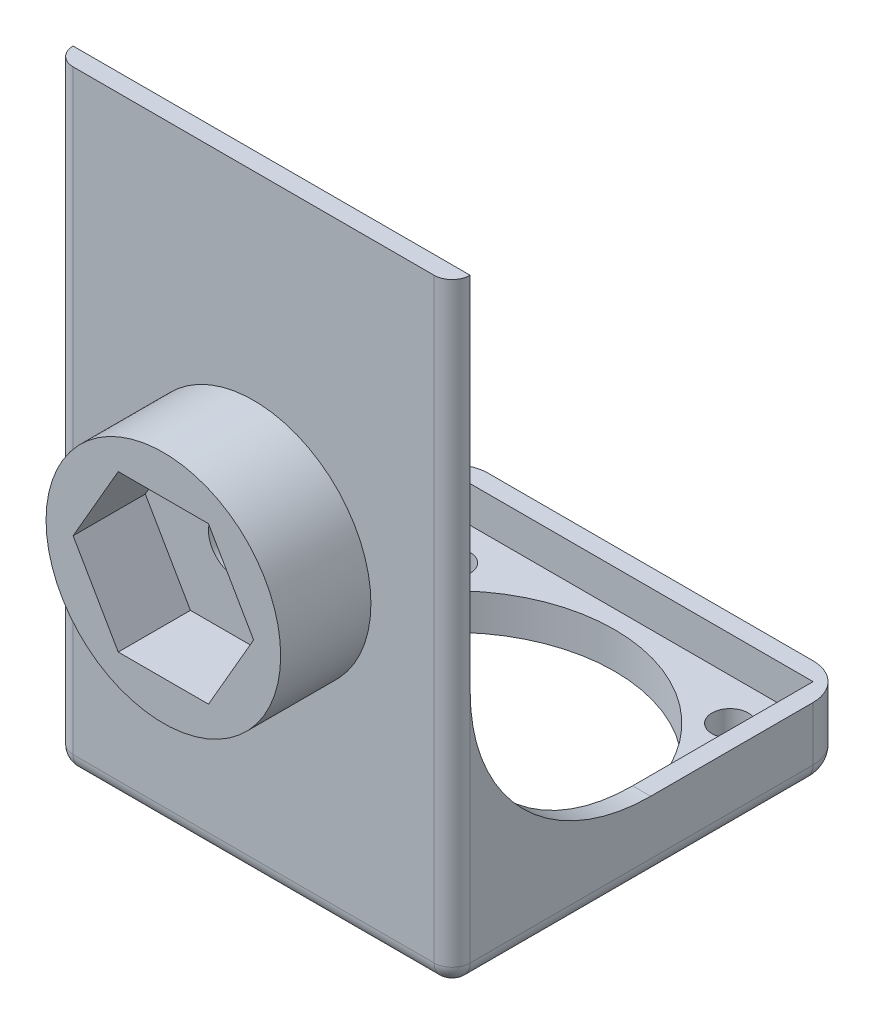
from build123d import *

# Parameters (mm, degrees)
SKETCH_1_W          = 22
SKETCH_1_H          = 22
SKETCH_1_W_2        = 20
SKETCH_1_H_2        = 20
EXTRUDE_1_DEPTH     = 4
SKETCH_2_W          = 20
SKETCH_2_H          = 20
EXTRUDE_2_DEPTH     = 2
CUT_EXTRUDE_1_DEPTH = 2
SKETCH_4_R          = 1
CUT_EXTRUDE_2_DEPTH = 2
EXTRUDE_4_DEPTH     = 30
CUT_EXTRUDE_3_DEPTH = 46.617978912
SKETCH_8_R          = 2.5
CUT_EXTRUDE_4_DEPTH = 4
SKETCH_10_R         = 6.5
EXTRUDE_5_DEPTH     = 5
CUT_EXTRUDE_5_DEPTH = 4
SKETCH_12_R         = 1.5
CUT_EXTRUDE_6_DEPTH = 4
FILLET_2_R          = 2
FILLET_3_R          = 2
FILLET_4_R          = 1
FILLET_5_R          = 1
FILLET_6_R          = 1


with BuildPart() as part:
    # 草图1 → 凸台-拉伸1 (new body)
    with BuildSketch(Plane(origin=(0, 0, 0), x_dir=(1, 0, 0), z_dir=(0, 1, 0))):
        with Locations((10, 10)):
            Rectangle(SKETCH_1_W, SKETCH_1_H)
        with Locations((10, 10)):
            Rectangle(SKETCH_1_W_2, SKETCH_1_H_2, mode=Mode.SUBTRACT)
    extrude(amount=EXTRUDE_1_DEPTH)

    # 草图2 → 凸台-拉伸2 (add)
    with BuildSketch(Plane(origin=(0, 0, 0), x_dir=(1, 0, 0), z_dir=(0, 1, 0))):
        with Locations((10, 10)):
            Rectangle(SKETCH_2_W, SKETCH_2_H)
    extrude(amount=EXTRUDE_2_DEPTH)

    # 草图3 → 切除-拉伸1 (cut)
    with BuildSketch(Plane(origin=(0, 2, 0), x_dir=(1, 0, 0), z_dir=(0, 1, 0))):
        with BuildLine():
            ThreePointArc((19, 10), (10, 19), (1, 10))
            Line((1, 10), (19, 10))
        make_face()
        with BuildLine():
            Line((19, 10), (1, 10))
            ThreePointArc((1, 10), (10, 1), (19, 10))
        make_face()
    extrude(amount=-CUT_EXTRUDE_1_DEPTH, mode=Mode.SUBTRACT)

    # 草图4 → 切除-拉伸2 (cut)
    with BuildSketch(Plane(origin=(0, 2, 0), x_dir=(1, 0, 0), z_dir=(0, 1, 0))):
        with Locations(Location((2.3, 17.7, 0), (0, 0, 270))):
            Circle(SKETCH_4_R)
        with Locations(Location((17.7, 17.7, 0), (0, 0, 270))):
            Circle(SKETCH_4_R)
        with Locations(Location((17.7, 2.3, 0), (0, 0, 270))):
            Circle(SKETCH_4_R)
        with Locations(Location((2.3, 2.3, 0), (0, 0, 270))):
            Circle(SKETCH_4_R)
    extrude(amount=-CUT_EXTRUDE_2_DEPTH, mode=Mode.SUBTRACT)

    # 草图5 → 凸台-拉伸4 (add)
    with BuildSketch(Plane(origin=(0, 4, 0), x_dir=(1, 0, 0), z_dir=(0, 1, 0))):
        Polygon((0, 0), (0, 10), (-1, 10), (-1, -1), (21, -1), (21, 10), (20, 10), (20, 0), align=None)
    extrude(amount=EXTRUDE_4_DEPTH)

    # 草图7 → 切除-拉伸3 (cut, through all)
    with BuildSketch(Plane.ZY.offset(1)):
        with BuildLine():
            ThreePointArc((-10, 4), (-2.928932188, 6.928932188), (0, 14))
            Line((0, 14), (-10, 14))
            Line((-10, 14), (-10, 4))
        make_face()
        with BuildLine():
            Line((-10, 14), (0, 14))
            ThreePointArc((0, 14), (-2.928932188, 21.071067812), (-10, 24))
            Line((-10, 24), (-10, 14))
        make_face()
        with BuildLine():
            Line((0, 14), (0, 34))
            Line((0, 34), (-10, 34))
            Line((-10, 34), (-10, 24))
            ThreePointArc((-10, 24), (-2.928932188, 21.071067812), (0, 14))
        make_face()
    extrude(amount=-CUT_EXTRUDE_3_DEPTH, mode=Mode.SUBTRACT)

    # 草图8 → 切除-拉伸4 (cut)
    with BuildSketch(Plane(origin=(0, 0, 0), x_dir=(-1, 0, 0), z_dir=(0, 0, -1))):
        with Locations((-10, 16.5)):
            Circle(SKETCH_8_R)
    extrude(amount=-CUT_EXTRUDE_4_DEPTH, mode=Mode.SUBTRACT)

    # 草图10 → 凸台-拉伸5 (add)
    with BuildSketch(Plane.XY.offset(1)):
        with Locations(Location((10, 16.5, 0), (0, 0, 180))):
            Circle(SKETCH_10_R)
    extrude(amount=EXTRUDE_5_DEPTH)

    # 草图11 → 切除-拉伸5 (cut)
    with BuildSketch(Plane.XY.offset(6)):
        Polygon((15, 16.5), (12.5, 20.830127019), (7.5, 20.830127019), (5, 16.5), (7.5, 12.169872981), (12.5, 12.169872981), align=None)
    extrude(amount=-CUT_EXTRUDE_5_DEPTH, mode=Mode.SUBTRACT)

    # 草图12 → 切除-拉伸6 (cut)
    with BuildSketch(Plane(origin=(0, 0, 1), x_dir=(-1, 0, 0), z_dir=(0, 0, -1))):
        with Locations((-10, 16.5)):
            Circle(SKETCH_12_R)
    extrude(amount=-CUT_EXTRUDE_6_DEPTH, mode=Mode.SUBTRACT)

    # 圆角2
    fillet_2_edges = [part.edges().sort_by_distance(p)[0] for p in [
        (-1, 2, -21),
    ]]
    fillet(fillet_2_edges, radius=FILLET_2_R)

    # 圆角3
    fillet_3_edges = [part.edges().sort_by_distance(p)[0] for p in [
        (21, 2, -21),
    ]]
    fillet(fillet_3_edges, radius=FILLET_3_R)

    # 圆角4
    fillet_4_edges = [part.edges().sort_by_distance(p)[0] for p in [
        (21, 17, 1),
    ]]
    fillet(fillet_4_edges, radius=FILLET_4_R - 0.0001)  # a hair under: the kernel refuses the full size

    # 圆角5
    fillet_5_edges = [part.edges().sort_by_distance(p)[0] for p in [
        (-1, 17, 1),
    ]]
    fillet(fillet_5_edges, radius=FILLET_5_R - 0.0001)  # a hair under: the kernel refuses the full size

    # 圆角6
    fillet_6_edges = [part.edges().sort_by_distance(p)[0] for p in [
        (-1, 0, -9.49995),
        (-0.414213562, 0, -20.414213562),
        (10, 0, -21),
        (20.414213562, 0, -20.414213562),
        (21, 0, -9.49995),
        (20.707136071, 0, 0.707136071),
        (10, 0, 1),
        (-0.707136071, 0, 0.707136071),
    ]]
    fillet(fillet_6_edges, radius=FILLET_6_R - 0.0001)  # a hair under: the kernel refuses the full size


solid = part.part
